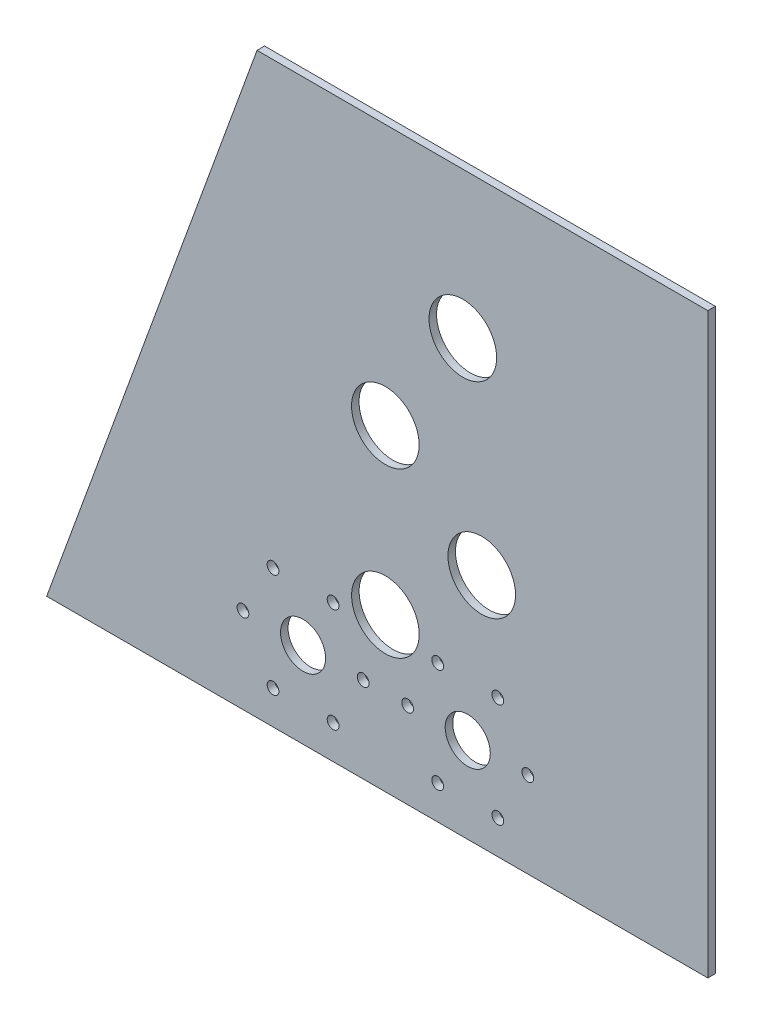
from build123d import *

# Parameters (mm, degrees)
SKETCH1_R           = 2.4892
SKETCH1_R_2         = 9.525
SKETCH1_R_3         = 14.2875
BOSS_EXTRUDE1_DEPTH = 3.175


with BuildPart() as part:
    # Sketch1 → Boss-Extrude1 (new body)
    with BuildSketch(Plane.XY):
        Polygon((0.126444903, 244.25074259), (-190.373555097, 244.25074259), (-279.273555097, 0), (0.126444903, 0), align=None)
        with Locations((-183.625246625, 14.243877264)):
            Circle(SKETCH1_R, mode=Mode.SUBTRACT)
        with Locations((-158.225246625, 14.243877264)):
            Circle(SKETCH1_R, mode=Mode.SUBTRACT)
        with Locations((-196.325246625, 36.24092252)):
            Circle(SKETCH1_R, mode=Mode.SUBTRACT)
        with Locations((-183.625246625, 58.237967776)):
            Circle(SKETCH1_R, mode=Mode.SUBTRACT)
        with Locations((-170.925246625, 36.24092252)):
            Circle(SKETCH1_R_2, mode=Mode.SUBTRACT)
        with Locations((-145.525246625, 36.24092252)):
            Circle(SKETCH1_R, mode=Mode.SUBTRACT)
        with Locations((-158.225246625, 58.237967776)):
            Circle(SKETCH1_R, mode=Mode.SUBTRACT)
        with Locations((-114.029246625, 14.243877264)):
            Circle(SKETCH1_R, mode=Mode.SUBTRACT)
        with Locations((-88.629246625, 14.243877264)):
            Circle(SKETCH1_R, mode=Mode.SUBTRACT)
        with Locations((-126.729246625, 36.24092252)):
            Circle(SKETCH1_R, mode=Mode.SUBTRACT)
        with Locations((-114.029246625, 58.237967776)):
            Circle(SKETCH1_R, mode=Mode.SUBTRACT)
        with Locations((-101.329246625, 36.24092252)):
            Circle(SKETCH1_R_2, mode=Mode.SUBTRACT)
        with Locations((-75.929246625, 36.24092252)):
            Circle(SKETCH1_R, mode=Mode.SUBTRACT)
        with Locations((-88.629246625, 58.237967776)):
            Circle(SKETCH1_R, mode=Mode.SUBTRACT)
        with Locations((-136.127246625, 64.806808111)):
            Circle(SKETCH1_R_3, mode=Mode.SUBTRACT)
        with Locations((-95.421649286, 99.600107565)):
            Circle(SKETCH1_R_3, mode=Mode.SUBTRACT)
        with Locations((-136.154667533, 134.070794552)):
            Circle(SKETCH1_R_3, mode=Mode.SUBTRACT)
        with Locations((-103.405808126, 182.370587185)):
            Circle(SKETCH1_R_3, mode=Mode.SUBTRACT)
    extrude(amount=BOSS_EXTRUDE1_DEPTH)


solid = part.part
